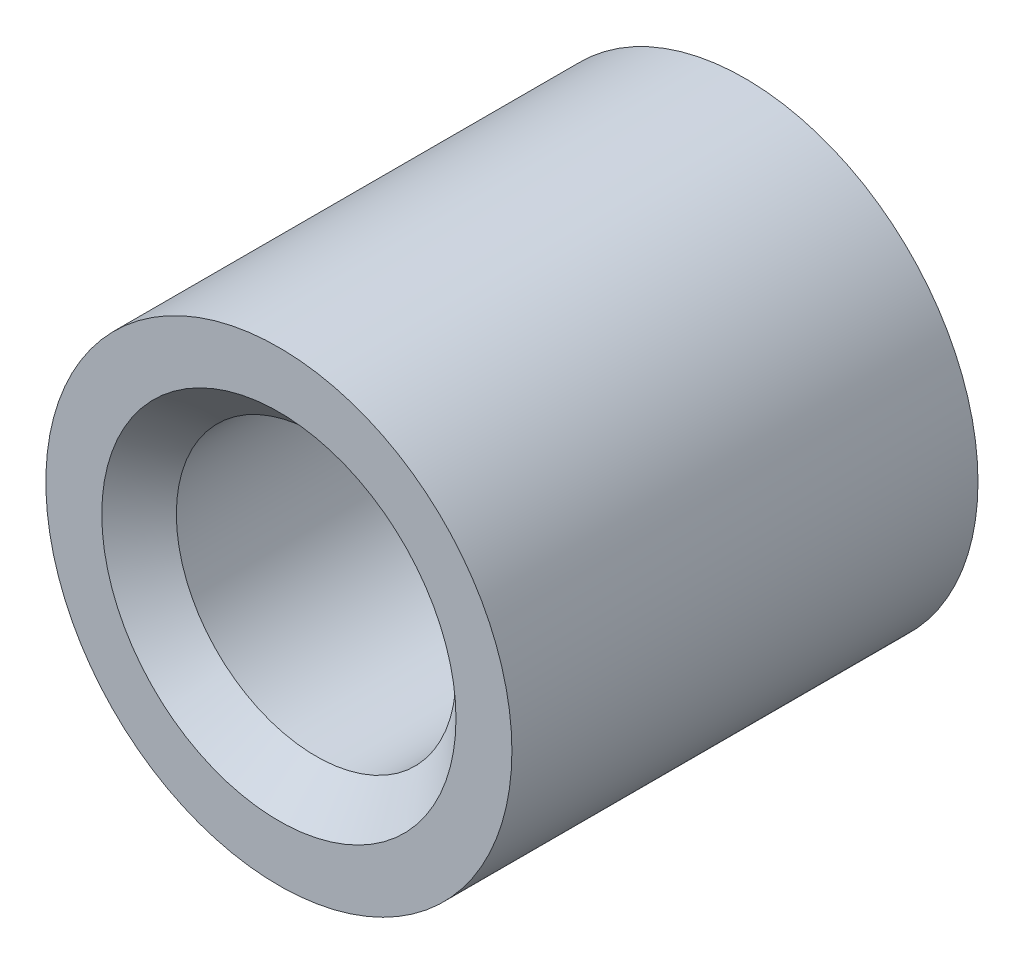
from build123d import *

# Parameters (mm, degrees)
SKETCH2_R     = 7.9375
SKETCH2_R_2   = 4.7625
TUBE_DEPTH    = 15.875
CHAMFER1_SIZE = 1.27


with BuildPart() as part:
    # Sketch2 → tube (new body)
    with BuildSketch(Plane.XY):
        Circle(SKETCH2_R)
        Circle(SKETCH2_R_2, mode=Mode.SUBTRACT)
    extrude(amount=TUBE_DEPTH)

    # Chamfer1
    chamfer1_edges = [part.edges().sort_by_distance(p)[0] for p in [
        (-4.7625, 0, 0),
        (-4.7625, 0, 15.875),
    ]]
    chamfer(chamfer1_edges, length=CHAMFER1_SIZE)


solid = part.part
